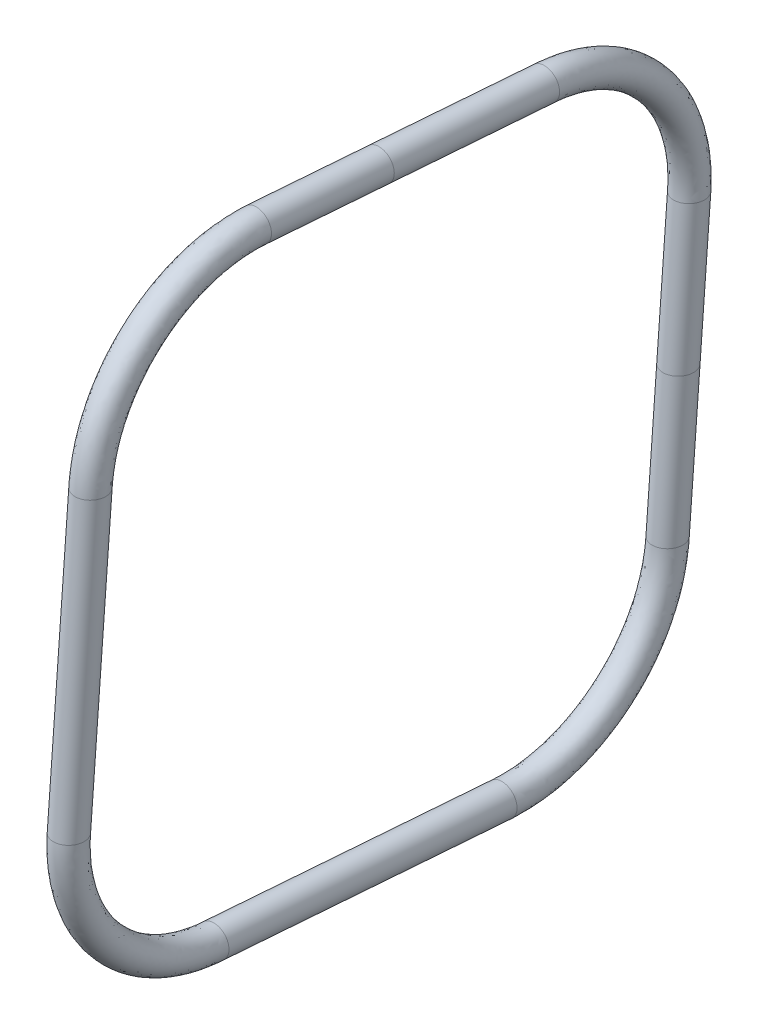
from build123d import *

# Parameters (mm, degrees)
SKETCH3_RX = 1.7653
SKETCH3_RY = 1.7399


with BuildPart() as part:
    # Sweep3: sweep along a path in Sketch4
    with BuildLine(Plane(origin=(0, 0, 0), x_dir=(0, 0, -1), z_dir=(1, 0, 0))) as sweep3_path:
        Line((-33.647493482, -14.019320477), (-31.184947753, 18.873107796))
        ThreePointArc((-31.184947753, 18.873107796), (-25.662009579, 29.815418452), (-14.019320477, 33.647493482))
        Line((-14.019320477, 33.647493482), (18.873107796, 31.184947753))
        ThreePointArc((18.873107796, 31.184947753), (29.815418452, 25.662009579), (33.647493482, 14.019320477))
        Line((33.647493482, 14.019320477), (32.416220618, -2.42689366))
        Line((32.416220618, -2.42689366), (31.184947753, -18.873107796))
        ThreePointArc((31.184947753, -18.873107796), (25.662009579, -29.815418452), (14.019320477, -33.647493482))
        Line((14.019320477, -33.647493482), (-18.873107796, -31.184947753))
        ThreePointArc((-18.873107796, -31.184947753), (-29.815418452, -25.662009579), (-33.647493482, -14.019320477))
    # Sketch3 → Sweep3 (sweep)
    with BuildSketch(Plane.XY):
        with Locations(Location((0, 34.363214002), (0, 0, -90))):
            Ellipse(SKETCH3_RX, SKETCH3_RY)
    sweep(path=sweep3_path.line)


solid = part.part
